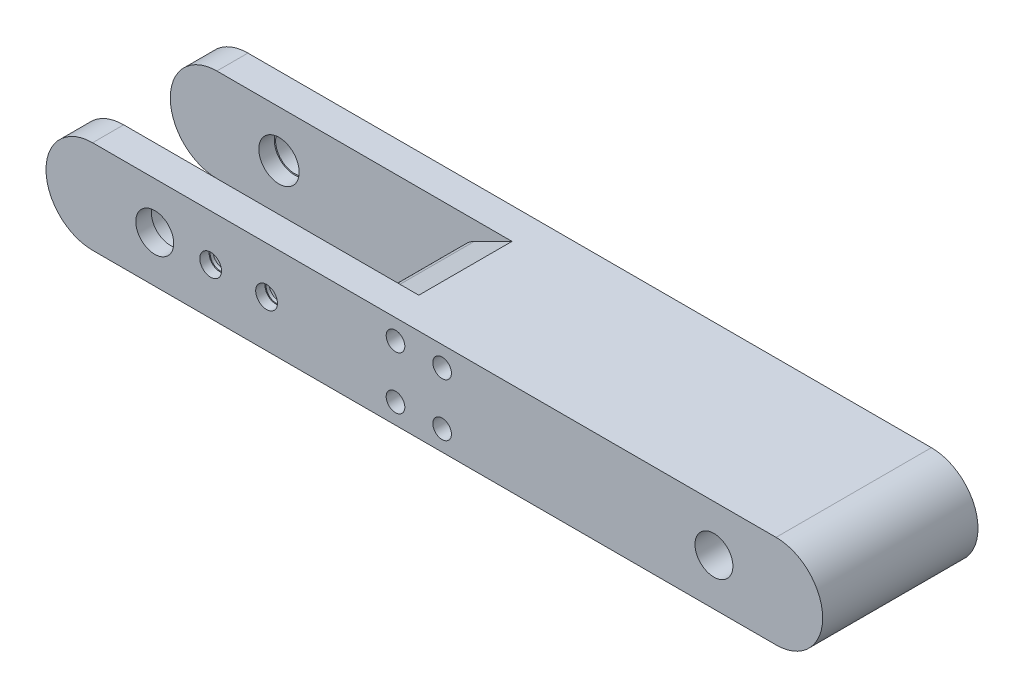
from build123d import *

# Parameters (mm, degrees)
SKETCH1_R           = 6.1
BOSS_EXTRUDE1_DEPTH = 25
SKETCH2_W           = 160
SKETCH2_H           = 30
CUT_EXTRUDE1_DEPTH  = 50
CUT_EXTRUDE5_DEPTH  = 30
CUT_EXTRUDE7_DEPTH  = 30
FILLET3_R           = 10
SKETCH8_R           = 3
CUT_EXTRUDE8_DEPTH  = 20
SKETCH9_R           = 3.15
CUT_EXTRUDE9_DEPTH  = 4
SKETCH10_R          = 3.5
CUT_EXTRUDE10_DEPTH = 3
SKETCH11_R          = 6.5
CUT_EXTRUDE11_DEPTH = 5
CUT_EXTRUDE12_START = -5
SKETCH12_R          = 6.5
CUT_EXTRUDE12_DEPTH = 5


with BuildPart() as part:
    # Sketch1 → Boss-Extrude1 (new, symmetric)
    with BuildSketch(Plane.XY):
        with BuildLine():
            Line((-110, -15), (110, -15))
            ThreePointArc((110, -15), (125, 0), (110, 15))
            Line((110, 15), (-110, 15))
            ThreePointArc((-110, 15), (-125, 0), (-110, -15))
        make_face()
        with Locations((-90, 0)):
            Circle(SKETCH1_R, mode=Mode.SUBTRACT)
        with Locations((90, 0)):
            Circle(SKETCH1_R, mode=Mode.SUBTRACT)
    extrude(amount=BOSS_EXTRUDE1_DEPTH, both=True)

    # Sketch2 → Cut-Extrude1 (cut)
    with BuildSketch(Plane(origin=(0, 15, 0), x_dir=(1, 0, 0), z_dir=(0, 1, 0))):
        with Locations((-125, 0)):
            Rectangle(SKETCH2_W, SKETCH2_H)
    extrude(amount=-CUT_EXTRUDE1_DEPTH, mode=Mode.SUBTRACT)

    # Sketch4 → Cut-Extrude5 (cut)
    with BuildSketch(Plane.XY.offset(15)):
        Polygon((-45, 15), (-45, 0), (-15, 15), align=None)
    extrude(amount=-CUT_EXTRUDE5_DEPTH, mode=Mode.SUBTRACT)

    # Sketch7 → Cut-Extrude7 (cut)
    with BuildSketch(Plane(origin=(0, 0, 15), x_dir=(-1, 0, 0), z_dir=(0, 0, -1))):
        Polygon((45, 0), (45, -15), (15, -15), align=None)
    extrude(amount=CUT_EXTRUDE7_DEPTH, mode=Mode.SUBTRACT)

    # Fillet3
    fillet3_edges = [part.edges().sort_by_distance(p)[0] for p in [
        (-45, 0, 0),
    ]]
    fillet(fillet3_edges, radius=FILLET3_R)

    # Sketch8 → Cut-Extrude8 (cut)
    with BuildSketch(Plane.XY.offset(25)):
        with Locations((-12.5, 8.5)):
            Circle(SKETCH8_R)
        with Locations((2.5, 8.5)):
            Circle(SKETCH8_R)
        with Locations((2.5, -8.5)):
            Circle(SKETCH8_R)
        with Locations((-12.5, -8.5)):
            Circle(SKETCH8_R)
    extrude(amount=-CUT_EXTRUDE8_DEPTH, mode=Mode.SUBTRACT)

    # Sketch9 → Cut-Extrude9 (cut)
    with BuildSketch(Plane.XY.offset(25)):
        with Locations((-72, 0)):
            Circle(SKETCH9_R)
        with Locations((-54, 0)):
            Circle(SKETCH9_R)
    extrude(amount=-CUT_EXTRUDE9_DEPTH, mode=Mode.SUBTRACT)

    # Sketch10 → Cut-Extrude10 (cut)
    with BuildSketch(Plane.XY.offset(25)):
        with Locations((-72, 0)):
            Circle(SKETCH10_R)
        with Locations((-54, 0)):
            Circle(SKETCH10_R)
    extrude(amount=-CUT_EXTRUDE10_DEPTH, mode=Mode.SUBTRACT)

    # Sketch11 → Cut-Extrude11 (cut)
    with BuildSketch(Plane(origin=(0, 0, 15), x_dir=(-1, 0, 0), z_dir=(0, 0, -1))):
        with Locations((90, 0)):
            Circle(SKETCH11_R)
    extrude(amount=-CUT_EXTRUDE11_DEPTH, mode=Mode.SUBTRACT)

    # Sketch12 → Cut-Extrude12 (cut)
    with BuildSketch(Plane.XY.offset(-15).offset(CUT_EXTRUDE12_START)):
        with Locations((-90, 0)):
            Circle(SKETCH12_R)
    extrude(amount=CUT_EXTRUDE12_DEPTH, mode=Mode.SUBTRACT)


solid = part.part
